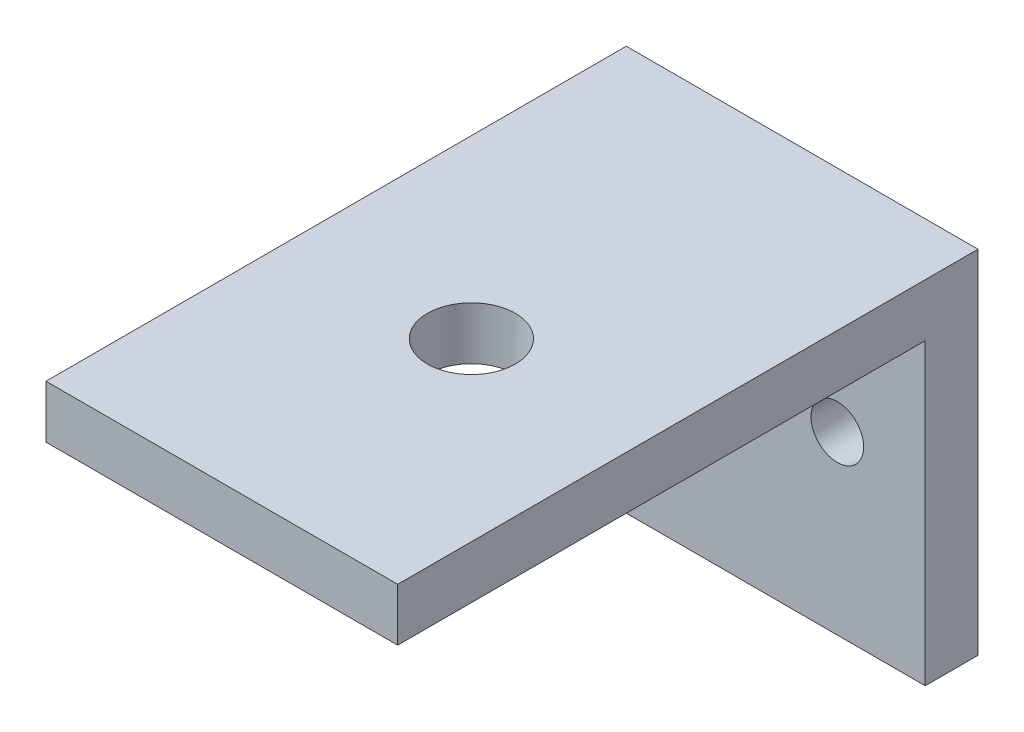
from build123d import *

# Parameters (mm, degrees)
SKETCH1_W           = 20
SKETCH1_H           = 20
BOSS_EXTRUDE1_DEPTH = 3
SKETCH2_W           = 20
SKETCH2_H           = 3
BOSS_EXTRUDE2_DEPTH = 30
SKETCH3_R           = 1.5
CUT_EXTRUDE1_DEPTH  = 20
SKETCH5_R           = 2.5
CUT_EXTRUDE2_DEPTH  = 20


with BuildPart() as part:
    # Sketch1 → Boss-Extrude1 (new body)
    with BuildSketch(Plane.XY):
        Rectangle(SKETCH1_W, SKETCH1_H)
    extrude(amount=BOSS_EXTRUDE1_DEPTH)

    # Sketch2 → Boss-Extrude2 (add)
    with BuildSketch(Plane.XY.offset(3)):
        with Locations((0, 8.5)):
            Rectangle(SKETCH2_W, SKETCH2_H)
    extrude(amount=BOSS_EXTRUDE2_DEPTH)

    # Sketch3 → Cut-Extrude1 (cut)
    with BuildSketch(Plane.XY.offset(3)):
        with Locations((-5, 0)):
            Circle(SKETCH3_R)
        with Locations((5, 0)):
            Circle(SKETCH3_R)
    extrude(amount=-CUT_EXTRUDE1_DEPTH, mode=Mode.SUBTRACT)

    # Sketch5 → Cut-Extrude2 (cut)
    with BuildSketch(Plane(origin=(0, 10, 0), x_dir=(1, 0, 0), z_dir=(0, 1, 0))):
        with Locations((0, -18.81)):
            Circle(SKETCH5_R)
    extrude(amount=-CUT_EXTRUDE2_DEPTH, mode=Mode.SUBTRACT)


solid = part.part
